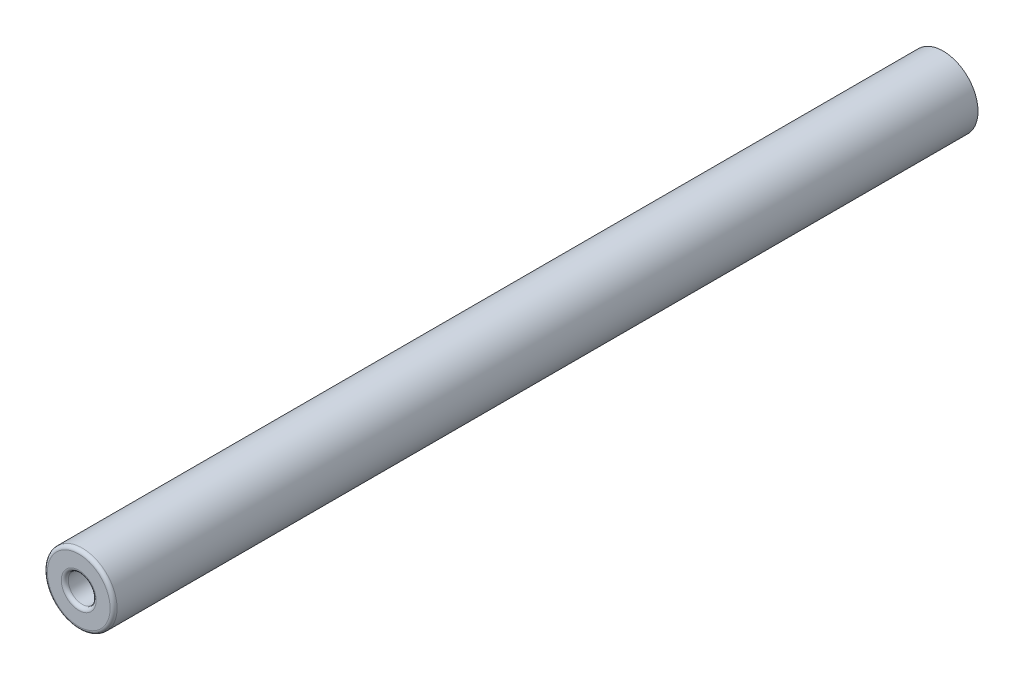
from build123d import *

# Parameters (mm, degrees)
CROQUIS1_R              = 2.5
SALIENTE_EXTRUIR1_DEPTH = 62
CROQUIS2_R              = 1
CORTAR_EXTRUIR1_DEPTH   = 10
REDONDEO1_R             = 0.25


with BuildPart() as part:
    # Croquis1 → Saliente-Extruir1 (new body)
    with BuildSketch(Plane.XY):
        Circle(CROQUIS1_R)
    extrude(amount=SALIENTE_EXTRUIR1_DEPTH)

    # Croquis2 → Cortar-Extruir1 (cut)
    with BuildSketch(Plane.XY.offset(62)):
        Circle(CROQUIS2_R)
    extrude(amount=-CORTAR_EXTRUIR1_DEPTH, mode=Mode.SUBTRACT)

    # Redondeo1
    redondeo1_edges = [part.edges().sort_by_distance(p)[0] for p in [
        (-2.5, 0, 62),
        (-1, 0, 62),
    ]]
    fillet(redondeo1_edges, radius=REDONDEO1_R)


solid = part.part
